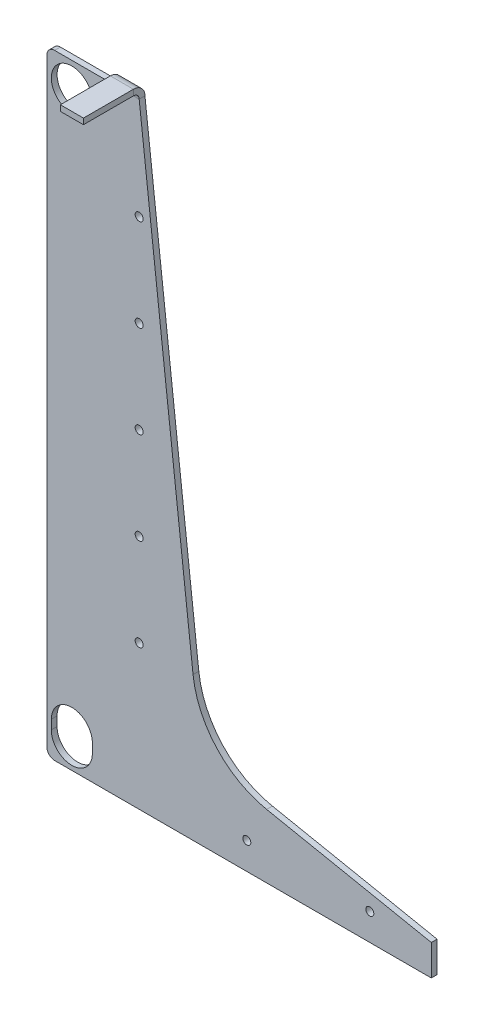
from build123d import *

# Parameters (mm, degrees)
BOSS_EXTRUDE1_DEPTH      = 3.175
SKETCH2_R                = 16.9545
CUT_EXTRUDE1_DEPTH       = 600.06621556
CONVERT_SOLID1_START     = -1.5875
CONVERT_SOLID1_OUTLINE_R = 16.9545
CONVERT_SOLID1_DEPTH     = 1.5875
EDGE_FLANGE3_DEPTH       = 19.05
SKETCH17_R               = 3.302
CUT_EXTRUDE4_DEPTH       = 609.89886437
CUT_EXTRUDE5_DEPTH       = 609.89886437
SKETCH19_R               = 3.302
CUT_EXTRUDE6_DEPTH       = 610.147146247


# Read off the part's stored shape, not the designer's step: Convert-Solid1
# Sheet-metal steps are written as plain solids
with BuildPart() as part:
    # Sketch1 → Boss-Extrude1 (new body)
    with BuildSketch(Plane.XY):
        with BuildLine():
            Line((6.35, 0), (317.5, 0))
            Line((317.5, 0), (317.5, 25.4))
            Line((317.5, 25.4), (181.457249023, 52.608550195))
            ThreePointArc((181.457249023, 52.608550195), (140.315142877, 75.746018143), (120.694108864, 118.676547437))
            Line((120.694108864, 118.676547437), (76.2, 508))
            Line((76.2, 508), (6.35, 508))
            ThreePointArc((6.35, 508), (1.859871939, 506.140128061), (0, 501.65))
            Line((0, 501.65), (0, 6.35))
            ThreePointArc((0, 6.35), (1.859871939, 1.859871939), (6.35, 0))
        make_face()
    extrude(amount=BOSS_EXTRUDE1_DEPTH)

    # Sketch2 → Cut-Extrude1 (cut, through all)
    with BuildSketch(Plane.XY.offset(3.175)):
        with Locations((20.574, 486.9942)):
            Circle(SKETCH2_R)
        with Locations((20.574, 20.574)):
            Circle(SKETCH2_R)
    extrude(amount=-CUT_EXTRUDE1_DEPTH, mode=Mode.SUBTRACT)

    # Convert-Solid1 outline → Convert-Solid1 (add)
    with BuildSketch(Plane.XY.offset(CONVERT_SOLID1_START)):
        with BuildLine():
            Line((317.5, 25.4), (181.457249023, 52.608550195))
            ThreePointArc((181.457249023, 52.608550195), (140.315142877, 75.746018143), (120.694108864, 118.676547437))
            Line((120.694108864, 118.676547437), (76.2, 508))
            Line((76.2, 508), (6.35, 508))
            ThreePointArc((6.35, 508), (1.859871939, 506.140128061), (0, 501.65))
            Line((0, 501.65), (0, 6.35))
            ThreePointArc((0, 6.35), (1.859871939, 1.859871939), (6.35, 0))
            Line((6.35, 0), (317.5, 0))
            Line((317.5, 0), (317.5, 25.4))
        make_face()
        with Locations((20.574, 20.574)):
            Circle(CONVERT_SOLID1_OUTLINE_R, mode=Mode.SUBTRACT)
        with Locations((20.574, 486.9942)):
            Circle(CONVERT_SOLID1_OUTLINE_R, mode=Mode.SUBTRACT)
    extrude(amount=CONVERT_SOLID1_DEPTH)

    # Edge-Flange3 section (across the edge) → Edge-Flange3 (add)
    with BuildSketch(Plane(origin=(76.2, 512.7625, 3.175), x_dir=(0, -1, 0), z_dir=(-1, 0, 0))):
        with BuildLine():
            Line((-4.7625, 4.7625), (-4.7625, 46.0375))
            Line((-4.7625, 46.0375), (0, 46.0375))
            Line((0, 46.0375), (0, 4.7625))
            ThreePointArc((0, 4.7625), (1.394903955, 1.394903955), (4.7625, 0))
            Line((4.7625, 0), (4.7625, -4.7625))
            ThreePointArc((4.7625, -4.7625), (-1.972692091, -1.972692091), (-4.7625, 4.7625))
        make_face()
    extrude(amount=EDGE_FLANGE3_DEPTH)

    # Sketch17 → Cut-Extrude4 (cut, through all)
    with BuildSketch(Plane.XY.offset(3.175)):
        with Locations((76.2, 423.892006342)):
            Circle(SKETCH17_R)
        with Locations((76.2, 347.692006342)):
            Circle(SKETCH17_R)
        with Locations((76.2, 271.492006342)):
            Circle(SKETCH17_R)
        with Locations((76.2, 195.292006342)):
            Circle(SKETCH17_R)
        with Locations((76.2, 119.092006342)):
            Circle(SKETCH17_R)
        with Locations((266.7, 22.225)):
            Circle(SKETCH17_R)
        with Locations((165.1, 22.225)):
            Circle(SKETCH17_R)
    extrude(amount=-CUT_EXTRUDE4_DEPTH, mode=Mode.SUBTRACT)

    # Sketch18 → Cut-Extrude5 (cut, through all)
    with BuildSketch(Plane.XY.offset(3.175)):
        with BuildLine():
            Line((3.6195, 28.2067), (3.6195, 20.574))
            ThreePointArc((3.6195, 20.574), (20.574, 3.6195), (37.5285, 20.574))
            Line((37.5285, 20.574), (37.5285, 28.2067))
            ThreePointArc((37.5285, 28.2067), (20.574, 45.1612), (3.6195, 28.2067))
        make_face()
    extrude(amount=-CUT_EXTRUDE5_DEPTH, mode=Mode.SUBTRACT)

    # Sketch19 → Cut-Extrude6 (cut, through all)
    with BuildSketch(Plane(origin=(0, 517.525, 0), x_dir=(0, 0, -1), z_dir=(0, 1, 0))):
        with Locations((-28.575, -82.55)):
            Circle(SKETCH19_R)
        with Locations((-28.575, -50.8)):
            Circle(SKETCH19_R)
    extrude(amount=-CUT_EXTRUDE6_DEPTH, mode=Mode.SUBTRACT)


solid = part.part
